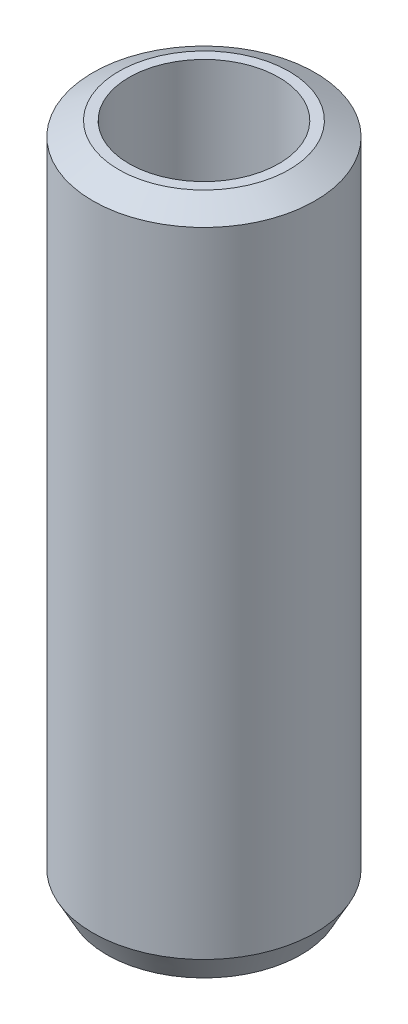
from build123d import *
from OCP.BRepFilletAPI import BRepFilletAPI_MakeChamfer

# Parameters (mm, degrees)
SKETCH1_R           = 17.5
BOSS_EXTRUDE1_DEPTH = 106.129228183
SKETCH2_R           = 11.790369227
CUT_EXTRUDE1_DEPTH  = 109.976662982
CHAMFER1_SIZE       = 2.211455146
CHAMFER1_SIZE2      = 4.084808834


with BuildPart() as part:
    # Sketch1 → Boss-Extrude1 (new body)
    with BuildSketch(Plane(origin=(0, 0, 0), x_dir=(1, 0, 0), z_dir=(0, 1, 0))):
        Circle(SKETCH1_R)
    extrude(amount=BOSS_EXTRUDE1_DEPTH)

    # Sketch2 → Cut-Extrude1 (cut, through all)
    with BuildSketch(Plane(origin=(0, 0, 0), x_dir=(1, 0, 0), z_dir=(0, 1, 0))):
        Circle(SKETCH2_R)
    extrude(amount=CUT_EXTRUDE1_DEPTH, mode=Mode.SUBTRACT)

    # Chamfer1: one chamfer whose edges measure the first distance from different faces: ONE call of the kernel's chamfer builder (chamfer() names one face for all edges)
    chamfer1_edges_1 = [part.edges().sort_by_distance(p)[0] for p in [
        (-17.5, 106.129228183, 0),
    ]]
    chamfer1_side_1 = [part.faces().sort_by_distance(p)[0] for p in [
        (-17.5, 53.064614092, 0),
    ]]
    chamfer1_edges_2 = [part.edges().sort_by_distance(p)[0] for p in [
        (-17.5, 0, 0),
    ]]
    chamfer1_side_2 = [part.faces().sort_by_distance(p)[0] for p in [
        (-17.005025253, 0, 0),
    ]]
    chamfer1 = BRepFilletAPI_MakeChamfer(part.part.solid().wrapped)
    for e in chamfer1_edges_1:
        chamfer1.Add(CHAMFER1_SIZE, CHAMFER1_SIZE2, e.wrapped, chamfer1_side_1[0].wrapped)  # the first distance lies on this face
    for e in chamfer1_edges_2:
        chamfer1.Add(CHAMFER1_SIZE, CHAMFER1_SIZE2, e.wrapped, chamfer1_side_2[0].wrapped)  # the first distance lies on this face
    add(Compound.cast(chamfer1.Shape()), mode=Mode.REPLACE)


solid = part.part
